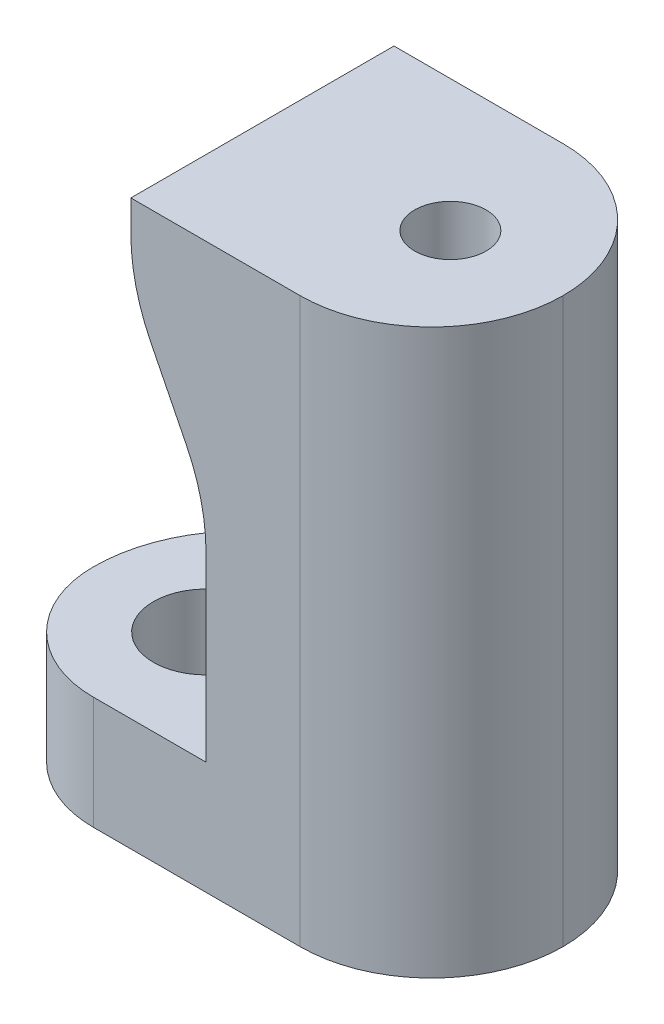
from build123d import *

# Parameters (mm, degrees)
BOSS_EXTRU_1_DEPTH      = 7
ESQUISSE2_R             = 1.4
ENL_V_MAT_EXTRU_1_DEPTH = 16.13274595
ESQUISSE3_R             = 0.95
ENL_V_MAT_EXTRU_2_DEPTH = 10
CONG_1_R                = 4
CONG_2_R                = 3
CONG_3_R                = 3.5
CONG_4_R                = 5


with BuildPart() as part:
    # Esquisse1 → Boss.-Extru.1 (new body)
    with BuildSketch(Plane.XY):
        Polygon((-2, 13), (0, 9), (0, 3), (-6, 3), (-6, 0), (0, 0), (6, 0), (6, 15), (-2, 15), align=None)
    extrude(amount=BOSS_EXTRU_1_DEPTH)

    # Esquisse2 → Enlèv. mat.-Extru.1 (cut, through all)
    with BuildSketch(Plane(origin=(0, 3, 0), x_dir=(1, 0, 0), z_dir=(0, 1, 0))):
        with Locations(Location((-3, -4, 0), (0, 0, 180))):
            Circle(ESQUISSE2_R)
    extrude(amount=-ENL_V_MAT_EXTRU_1_DEPTH, mode=Mode.SUBTRACT)

    # Esquisse3 → Enlèv. mat.-Extru.2 (cut)
    with BuildSketch(Plane(origin=(0, 15, 0), x_dir=(1, 0, 0), z_dir=(0, 1, 0))):
        with Locations(Location((3, -3.5, 0), (0, 0, 270))):
            Circle(ESQUISSE3_R)
    extrude(amount=-ENL_V_MAT_EXTRU_2_DEPTH, mode=Mode.SUBTRACT)

    # Congé1
    cong_1_edges = [part.edges().sort_by_distance(p)[0] for p in [
        (-6, 1.5, 0),
    ]]
    fillet(cong_1_edges, radius=CONG_1_R)

    # Congé2
    cong_2_edges = [part.edges().sort_by_distance(p)[0] for p in [
        (-6, 1.5, 7),
    ]]
    fillet(cong_2_edges, radius=CONG_2_R - 0.0001)  # a hair under: the kernel refuses the full size

    # Congé3
    cong_3_edges = [part.edges().sort_by_distance(p)[0] for p in [
        (6, 7.5, 7),
        (6, 7.5, 0),
    ]]
    fillet(cong_3_edges, radius=CONG_3_R - 0.0001)  # a hair under: the kernel refuses the full size

    # Congé4
    cong_4_edges = [part.edges().sort_by_distance(p)[0] for p in [
        (0, 9, 3.5),
        (-2, 13, 3.5),
    ]]
    fillet(cong_4_edges, radius=CONG_4_R)


solid = part.part
